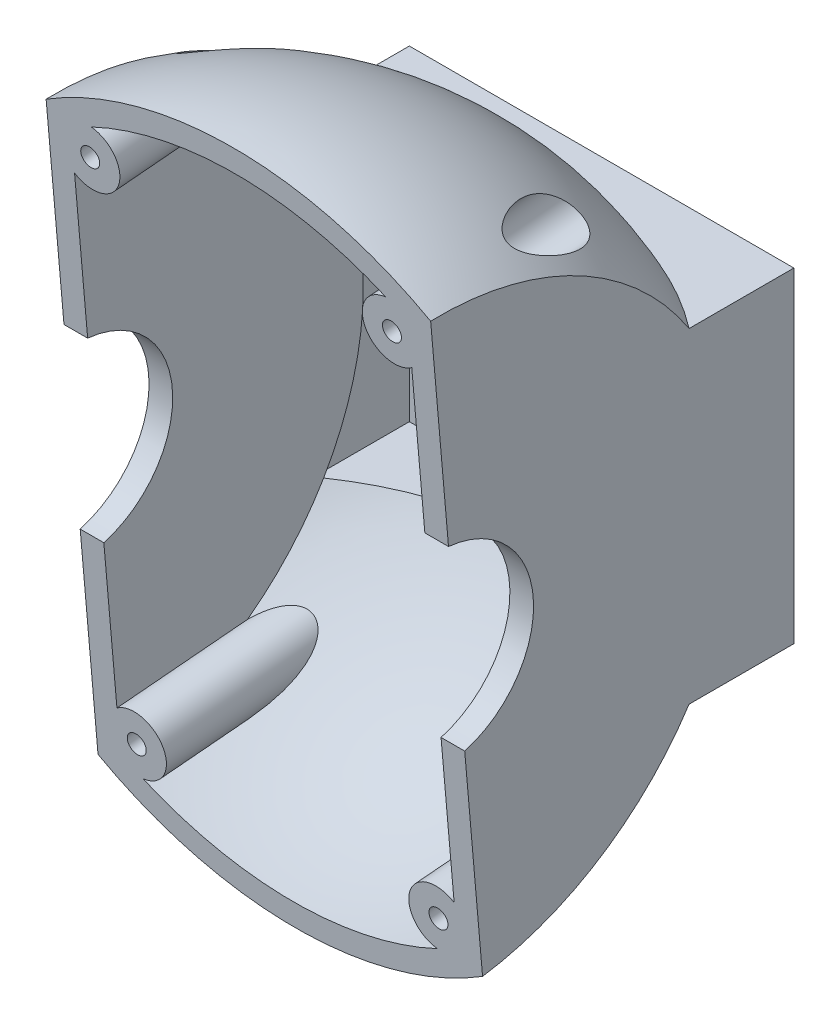
from build123d import *

# Parameters (mm, degrees)
BOSS_EXTRUDE7_REACH     = 140.044
SKETCH13_W              = 65
SKETCH13_H              = 55
CUT_EXTRUDE1_REACH      = 108.888
SKETCH3_R               = 10
BOSS_EXTRUDE2_START     = 1
SKETCH4_R               = 12
SKETCH4_R_2             = 10
BOSS_EXTRUDE2_DEPTH     = 1
CUT_EXTRUDE4_REACH      = 137.688
CUT_EXTRUDE4_END_RADIUS = 56
SKETCH15_W              = 59
SKETCH15_H              = 49
CUT_EXTRUDE5_REACH      = 109.499
SKETCH16_R              = 7.5
BOSS_EXTRUDE8_START     = 10
SKETCH18_R              = 9.5
SKETCH18_R_2            = 7.5
BOSS_EXTRUDE8_DEPTH     = 10
BOSS_EXTRUDE9_START     = 1
SKETCH19_R              = 11.5
SKETCH19_R_2            = 9.5
BOSS_EXTRUDE9_DEPTH     = 1
CUT_EXTRUDE2_DEPTH      = 95.901264481
CUT_EXTRUDE2_DEPTH_BACK = 95.901264481
SKETCH5_OUTSIDE_W       = 159.19
SKETCH5_OUTSIDE_H       = 159.19
BOSS_EXTRUDE11_REACH    = 90.743
SKETCH24_R              = 5
SKETCH25_R              = 4.5
CUT_EXTRUDE7_DEPTH      = 55
M3_CLEARANCE_HOLE2_D    = 3.2
SKETCH28_W              = 53
SKETCH28_H              = 43
TEMPORARY_CUT_DEPTH     = 3


with BuildPart() as part:
    # Sketch1 → Revolve1 (revolve)
    with BuildSketch(Plane.XY):
        with BuildLine():
            Line((-32.5, 50.435602505), (-32.5, 0))
            Line((-32.5, 0), (-28.5, 0))
            Line((-28.5, 0), (-28.5, 48.205290166))
            ThreePointArc((-28.5, 48.205290166), (0, 56), (28.5, 48.205290166))
            Line((28.5, 48.205290166), (28.5, 0))
            Line((28.5, 0), (32.5, 0))
            Line((32.5, 0), (32.5, 50.435602505))
            ThreePointArc((32.5, 50.435602505), (0, 60), (-32.5, 50.435602505))
        make_face()
    revolve(axis=Axis((-32.5, 0, 0), (1, 0, 0)))

    # Sketch13 → Boss-Extrude7 (add, up to next)
    with BuildSketch(Plane(origin=(0, 0, -60), x_dir=(-1, 0, 0), z_dir=(0, 0, -1)), mode=Mode.PRIVATE) as boss_extrude7_sk1:
        Rectangle(SKETCH13_W, SKETCH13_H)
    boss_extrude7_tool1 = extrude(boss_extrude7_sk1.sketch, amount=-BOSS_EXTRUDE7_REACH, mode=Mode.PRIVATE) - part.part
    add(boss_extrude7_tool1.solids().sort_by_distance((0, 0, -60))[0])

    # Sketch3 → Cut-Extrude1 (cut, up to next)
    with BuildSketch(Plane(origin=(32.5, 0, 0), x_dir=(0, 0, -1), z_dir=(1, 0, 0)), mode=Mode.PRIVATE) as cut_extrude1_sk1:
        with Locations(Location((0, 0, 0), (0, 0, 90))):
            Circle(SKETCH3_R)
    cut_extrude1_tool1 = extrude(cut_extrude1_sk1.sketch, amount=-CUT_EXTRUDE1_REACH, mode=Mode.PRIVATE) & part.part
    add(cut_extrude1_tool1.solids().sort_by_distance((32.5, 0, 0))[0], mode=Mode.SUBTRACT)

    # Sketch4 → Boss-Extrude2 (add)
    with BuildSketch(Plane(origin=(32.5, 0, 0), x_dir=(0, 0, -1), z_dir=(1, 0, 0)).offset(BOSS_EXTRUDE2_START)):
        with Locations(Location((0, 0, 0), (0, 0, 90))):
            Circle(SKETCH4_R)
        with Locations(Location((0, 0, 0), (0, 0, 90))):
            Circle(SKETCH4_R_2, mode=Mode.SUBTRACT)
    extrude(amount=-BOSS_EXTRUDE2_DEPTH)

    # Cut-Extrude4: up to this sphere (the profile starts outside it)
    cut_extrude4_end = Location((0, 0, 0)) * Sphere(CUT_EXTRUDE4_END_RADIUS, mode=Mode.PRIVATE)
    # Sketch15 → Cut-Extrude4 (cut, up to the surface)
    with BuildSketch(Plane(origin=(0, 0, -57), x_dir=(-1, 0, 0), z_dir=(0, 0, -1)), mode=Mode.PRIVATE) as cut_extrude4_sk1:
        Rectangle(SKETCH15_W, SKETCH15_H)
    cut_extrude4_tool1 = extrude(cut_extrude4_sk1.sketch, amount=-CUT_EXTRUDE4_REACH, mode=Mode.PRIVATE) - cut_extrude4_end
    add(cut_extrude4_tool1.solids().sort_by_distance((0, 0, -57))[0], mode=Mode.SUBTRACT)

    # Sketch16 → Cut-Extrude5 (cut, up to next)
    with BuildSketch(Plane.ZY.offset(32.5), mode=Mode.PRIVATE) as cut_extrude5_sk1:
        with Locations(Location((0, 0, 0), (0, 0, 270))):
            Circle(SKETCH16_R)
    cut_extrude5_tool1 = extrude(cut_extrude5_sk1.sketch, amount=-CUT_EXTRUDE5_REACH, mode=Mode.PRIVATE) & part.part
    add(cut_extrude5_tool1.solids().sort_by_distance((-32.5, 0, 0))[0], mode=Mode.SUBTRACT)

    # Sketch18 → Boss-Extrude8 (add)
    with BuildSketch(Plane.ZY.offset(32.5).offset(BOSS_EXTRUDE8_START)):
        with Locations(Location((0, 0, 0), (0, 0, 270))):
            Circle(SKETCH18_R)
        with Locations(Location((0, 0, 0), (0, 0, 270))):
            Circle(SKETCH18_R_2, mode=Mode.SUBTRACT)
    extrude(amount=-BOSS_EXTRUDE8_DEPTH)

    # Sketch19 → Boss-Extrude9 (add)
    with BuildSketch(Plane.ZY.offset(32.5).offset(BOSS_EXTRUDE9_START)):
        with Locations(Location((0, 0, 0), (0, 0, 270))):
            Circle(SKETCH19_R)
        with Locations(Location((0, 0, 0), (0, 0, 270))):
            Circle(SKETCH19_R_2, mode=Mode.SUBTRACT)
    extrude(amount=-BOSS_EXTRUDE9_DEPTH)

    # Sketch5 outside → Cut-Extrude2 (cut, two sides: drawn at the far end of the back side and taken through both)
    with BuildSketch(Plane(origin=(0, 0, 0), x_dir=(0, 0, -1), z_dir=(1, 0, 0)).offset(-CUT_EXTRUDE2_DEPTH_BACK)):
        Rectangle(SKETCH5_OUTSIDE_W, SKETCH5_OUTSIDE_H)
        with BuildLine():
            Line((4.358344111, -15.394961403), (8.260779324, -60))
            Line((8.260779324, -60), (60, -60))
            Line((60, -60), (60, 60))
            Line((60, 60), (-2.237860299, 60))
            Line((-2.237860299, 60), (1.618824078, 15.91789586))
            ThreePointArc((1.618824078, 15.91789586), (15.939115169, 1.394491884), (4.358344111, -15.394961403))
        make_face(mode=Mode.SUBTRACT)
    extrude(amount=CUT_EXTRUDE2_DEPTH + CUT_EXTRUDE2_DEPTH_BACK, mode=Mode.SUBTRACT)

    # Sketch24 → Boss-Extrude11 (add, up to next)
    with BuildSketch(Plane(origin=(0, 0.261467228, -2.988584094), x_dir=(1, 0, 0), z_dir=(0, -0.08715574274766201, 0.9961946980917452)), mode=Mode.PRIVATE) as boss_extrude11_sk1:
        with Locations((-25.5, 45.111848852)):
            Circle(SKETCH24_R)
    boss_extrude11_tool1 = extrude(boss_extrude11_sk1.sketch, amount=-BOSS_EXTRUDE11_REACH, mode=Mode.PRIVATE) - part.part
    # Sketch24 → Boss-Extrude11 (add, up to next)
    with BuildSketch(Plane(origin=(0, 0.261467228, -2.988584094), x_dir=(1, 0, 0), z_dir=(0, -0.08715574274766201, 0.9961946980917452)), mode=Mode.PRIVATE) as boss_extrude11_sk2:
        with Locations((25.5, 45.111848852)):
            Circle(SKETCH24_R)
    boss_extrude11_tool2 = extrude(boss_extrude11_sk2.sketch, amount=-BOSS_EXTRUDE11_REACH, mode=Mode.PRIVATE) - part.part
    # Sketch24 → Boss-Extrude11 (add, up to next)
    with BuildSketch(Plane(origin=(0, 0.261467228, -2.988584094), x_dir=(1, 0, 0), z_dir=(0, -0.08715574274766201, 0.9961946980917452)), mode=Mode.PRIVATE) as boss_extrude11_sk3:
        with Locations((-25.5, -45.111848852)):
            Circle(SKETCH24_R)
    boss_extrude11_tool3 = extrude(boss_extrude11_sk3.sketch, amount=-BOSS_EXTRUDE11_REACH, mode=Mode.PRIVATE) - part.part
    # Sketch24 → Boss-Extrude11 (add, up to next)
    with BuildSketch(Plane(origin=(0, 0.261467228, -2.988584094), x_dir=(1, 0, 0), z_dir=(0, -0.08715574274766201, 0.9961946980917452)), mode=Mode.PRIVATE) as boss_extrude11_sk4:
        with Locations((25.5, -45.111848852)):
            Circle(SKETCH24_R)
    boss_extrude11_tool4 = extrude(boss_extrude11_sk4.sketch, amount=-BOSS_EXTRUDE11_REACH, mode=Mode.PRIVATE) - part.part
    add(boss_extrude11_tool1.solids().sort_by_distance((-25.5, 45.201652, 0.943173))[0])
    add(boss_extrude11_tool2.solids().sort_by_distance((25.5, 45.201652, 0.943173))[0])
    add(boss_extrude11_tool3.solids().sort_by_distance((-25.5, -44.678717, -6.920341))[0])
    add(boss_extrude11_tool4.solids().sort_by_distance((25.5, -44.678717, -6.920341))[0])

    # Sketch25 → Cut-Extrude7 (cut)
    with BuildSketch(Plane(origin=(0, 5.229344565, -59.771681886), x_dir=(-1, 0, 0), z_dir=(0, 0.08715574274766201, -0.9961946980917452))):
        with Locations(Location((-25.5, 45.111848852, 0), (0, 0, 303.576543734))):
            Circle(SKETCH25_R)
        with Locations(Location((25.5, 45.111848852, 0), (0, 0, 260.284621119))):
            Circle(SKETCH25_R)
        with Locations(Location((-25.5, -45.111848852, 0), (0, 0, 60.098494947))):
            Circle(SKETCH25_R)
        with Locations(Location((25.5, -45.111848852, 0), (0, 0, 119.465088876))):
            Circle(SKETCH25_R)
    extrude(amount=-CUT_EXTRUDE7_DEPTH, mode=Mode.SUBTRACT)

    # M3 Clearance Hole2 (through all)
    with Locations(Plane(origin=(0, 5.229344565, -59.771681886), x_dir=(-1, 0, 0), z_dir=(0, 0.08715574274766201, -0.9961946980917452))):
        with Locations((-25.5, 45.111848852), (25.5, 45.111848852), (25.5, -45.111848852), (-25.5, -45.111848852)):
            Hole(M3_CLEARANCE_HOLE2_D / 2)

    # Sketch28 → TEMPORARY CUT (cut)
    with BuildSketch(Plane(origin=(0, 0, -60), x_dir=(-1, 0, 0), z_dir=(0, 0, -1))):
        Rectangle(SKETCH28_W, SKETCH28_H)
    extrude(amount=-TEMPORARY_CUT_DEPTH, mode=Mode.SUBTRACT)


solid = part.part
